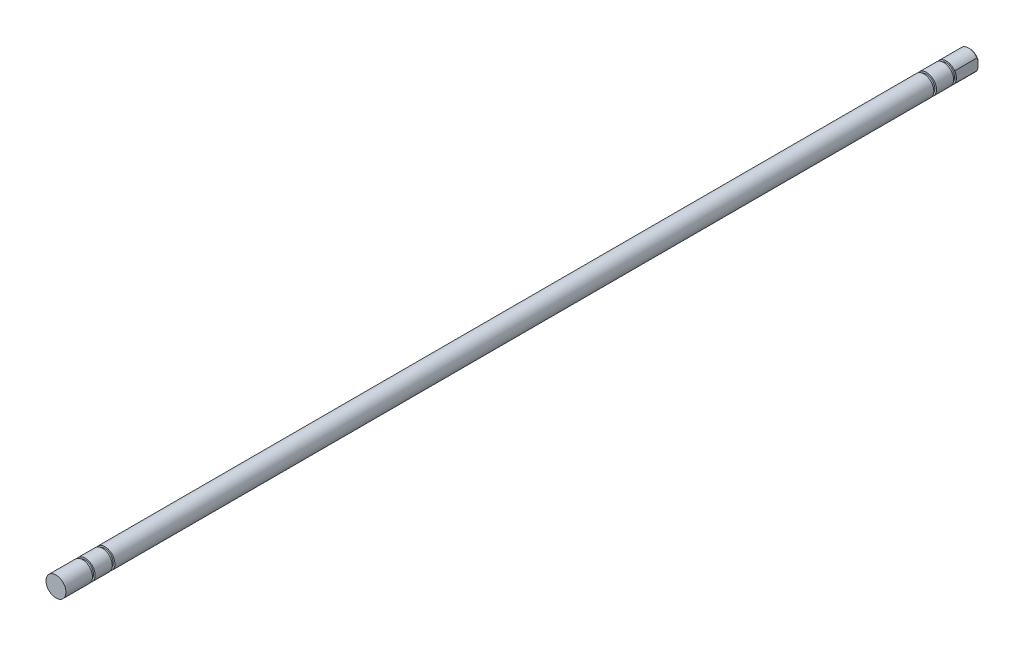
from build123d import *

# Parameters (mm, degrees)
SKETCH1_R               = 3
BOSS_EXTRUDE1_DEPTH     = 275
SKETCH3_W               = 0.8
SKETCH3_H               = 0.5
CUT_EXTRUDE2_DEPTH      = 276.032725326
CUT_EXTRUDE2_DEPTH_BACK = 276.032725326
SKETCH4_W               = 3.470061058
SKETCH4_H               = 7
SKETCH4_W_2             = 2.92528695
CHAMFER1_SIZE           = 0.3


with BuildPart() as part:
    # Sketch1 → Boss-Extrude1 (new body)
    with BuildSketch(Plane.XY):
        Circle(SKETCH1_R)
    extrude(amount=BOSS_EXTRUDE1_DEPTH)

    # Sketch3 → Cut-Revolve1 (revolve, cut)
    with BuildSketch(Plane(origin=(0, 0, 0), x_dir=(0, 0, -1), z_dir=(1, 0, 0))):
        with Locations((-266.6, 2.75)):
            Rectangle(SKETCH3_W, SKETCH3_H)
        with Locations((-260.65, 2.75)):
            Rectangle(SKETCH3_W, SKETCH3_H)
        with Locations((-13.4, 2.75)):
            Rectangle(SKETCH3_W, SKETCH3_H)
        with Locations((-7.45, 2.75)):
            Rectangle(SKETCH3_W, SKETCH3_H)
    revolve(axis=Axis((0, 0, 263.365004794), (0, 0, -1)), mode=Mode.SUBTRACT)

    # Sketch4 → Cut-Extrude2 (cut, two sides: drawn at the far end of the back side and taken through both)
    with BuildSketch(Plane(origin=(0, 0, 0), x_dir=(1, 0, 0), z_dir=(0, 1, 0)).offset(-CUT_EXTRUDE2_DEPTH_BACK)):
        with Locations((4.235030529, -3.5)):
            Rectangle(SKETCH4_W, SKETCH4_H)
        with Locations((-3.962643475, -3.5)):
            Rectangle(SKETCH4_W_2, SKETCH4_H)
    extrude(amount=CUT_EXTRUDE2_DEPTH + CUT_EXTRUDE2_DEPTH_BACK, mode=Mode.SUBTRACT)

    # Chamfer1
    chamfer1_edges = [part.edges().sort_by_distance(p)[0] for p in [
        (0, 3, 0),
        (0, -3, 0),
    ]]
    chamfer(chamfer1_edges, length=CHAMFER1_SIZE)


solid = part.part
